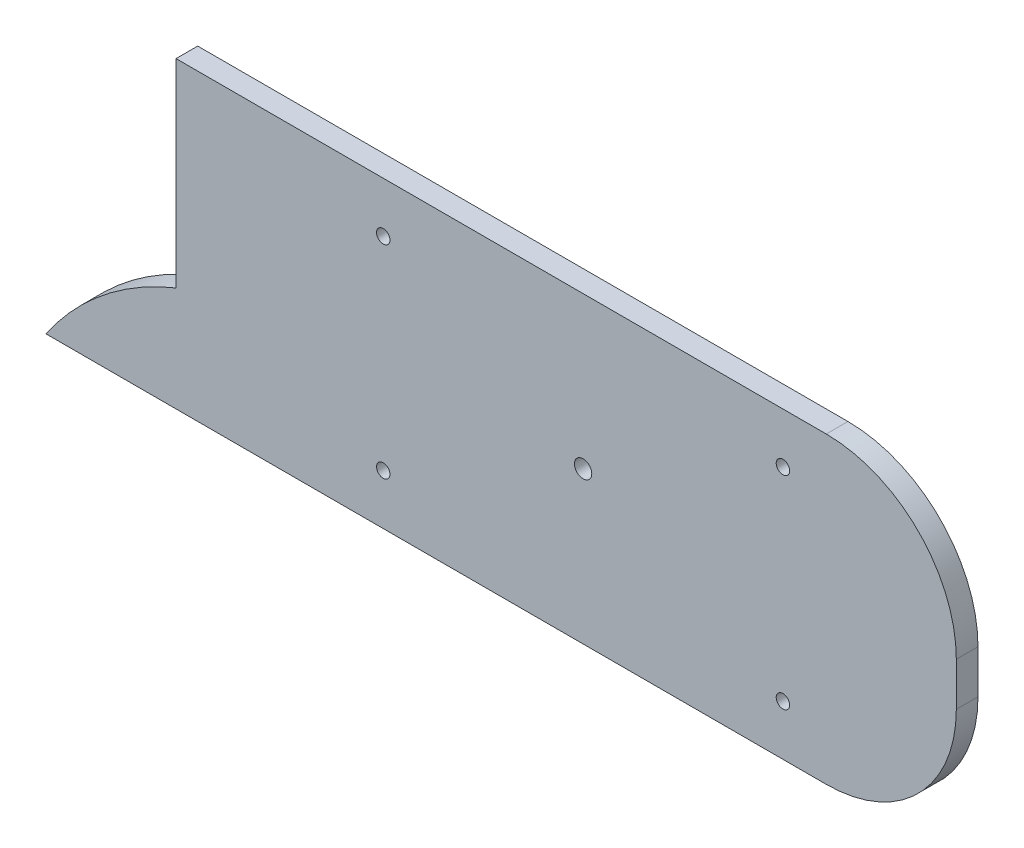
from build123d import *

# Parameters (mm, degrees)
BOSS_EXTRUDE1_DEPTH = 12.7
SKETCH4_R           = 5.08
SKETCH4_R_2         = 3.937
CUT_EXTRUDE2_DEPTH  = 563.396381567


with BuildPart() as part:
    # Sketch2 → Boss-Extrude1 (new body)
    with BuildSketch(Plane.XY):
        with BuildLine():
            Line((0, 0), (457.2, 0))
            ThreePointArc((457.2, 0), (511.081536726, 22.318463274), (533.4, 76.2))
            Line((533.4, 76.2), (533.4, 101.6))
            ThreePointArc((533.4, 101.6), (511.081536726, 155.481536726), (457.2, 177.8))
            Line((457.2, 177.8), (152.4, 177.8))
            Line((152.4, 177.8), (76.2, 177.8))
            Line((76.2, 177.8), (76.2, 61.401251199))
            ThreePointArc((76.2, 61.401251199), (33.506060073, 36.401783403), (0, 0))
        make_face()
    extrude(amount=BOSS_EXTRUDE1_DEPTH)

    # Sketch4 → Cut-Extrude2 (cut, through all)
    with BuildSketch(Plane.XY.offset(12.7)):
        with Locations((314.706, 88.9)):
            Circle(SKETCH4_R)
        with Locations((431.8, 148.336)):
            Circle(SKETCH4_R_2)
        with Locations((197.612, 148.336)):
            Circle(SKETCH4_R_2)
        with Locations((197.612, 29.464)):
            Circle(SKETCH4_R_2)
        with Locations((431.8, 29.464)):
            Circle(SKETCH4_R_2)
    extrude(amount=-CUT_EXTRUDE2_DEPTH, mode=Mode.SUBTRACT)


solid = part.part
